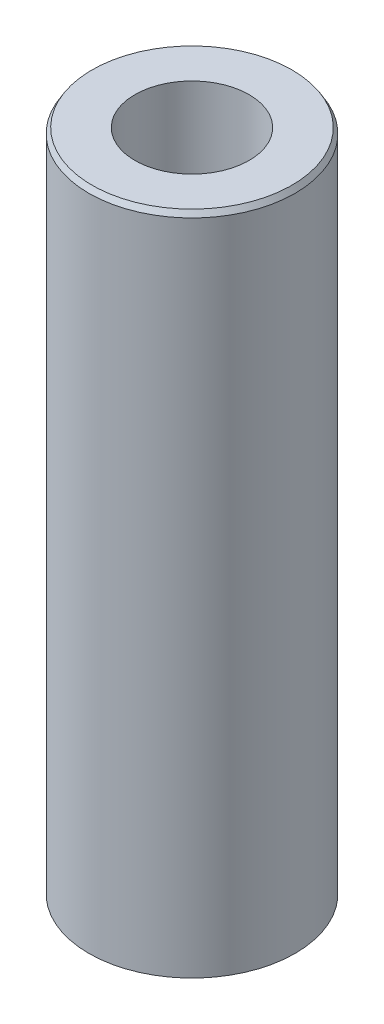
from build123d import *
from OCP.BRepFilletAPI import BRepFilletAPI_MakeChamfer

# Parameters (mm, degrees)
SKETCH1_R           = 60
BOSS_EXTRUDE1_DEPTH = 387.838968142
SKETCH2_R           = 33.199964395
CUT_EXTRUDE1_DEPTH  = 398.012676384
CHAMFER1_SIZE       = 3.126166174
CHAMFER1_SIZE2      = 1.873881057


with BuildPart() as part:
    # Sketch1 → Boss-Extrude1 (new body)
    with BuildSketch(Plane(origin=(0, 0, 0), x_dir=(1, 0, 0), z_dir=(0, 1, 0))):
        Circle(SKETCH1_R)
    extrude(amount=BOSS_EXTRUDE1_DEPTH)

    # Sketch2 → Cut-Extrude1 (cut, through all)
    with BuildSketch(Plane(origin=(0, 0, 0), x_dir=(1, 0, 0), z_dir=(0, 1, 0))):
        Circle(SKETCH2_R)
    extrude(amount=CUT_EXTRUDE1_DEPTH, mode=Mode.SUBTRACT)

    # Chamfer1: one chamfer whose edges measure the first distance from different faces: ONE call of the kernel's chamfer builder (chamfer() names one face for all edges)
    chamfer1_edges_1 = [part.edges().sort_by_distance(p)[0] for p in [
        (-60, 387.838968142, 0),
    ]]
    chamfer1_side_1 = [part.faces().sort_by_distance(p)[0] for p in [
        (-60, 193.919484071, 0),
    ]]
    chamfer1_edges_2 = [part.edges().sort_by_distance(p)[0] for p in [
        (-60, 0, 0),
    ]]
    chamfer1_side_2 = [part.faces().sort_by_distance(p)[0] for p in [
        (-58.302943725, 0, 0),
    ]]
    chamfer1 = BRepFilletAPI_MakeChamfer(part.part.solid().wrapped)
    for e in chamfer1_edges_1:
        chamfer1.Add(CHAMFER1_SIZE, CHAMFER1_SIZE2, e.wrapped, chamfer1_side_1[0].wrapped)  # the first distance lies on this face
    for e in chamfer1_edges_2:
        chamfer1.Add(CHAMFER1_SIZE, CHAMFER1_SIZE2, e.wrapped, chamfer1_side_2[0].wrapped)  # the first distance lies on this face
    add(Compound.cast(chamfer1.Shape()), mode=Mode.REPLACE)


solid = part.part
